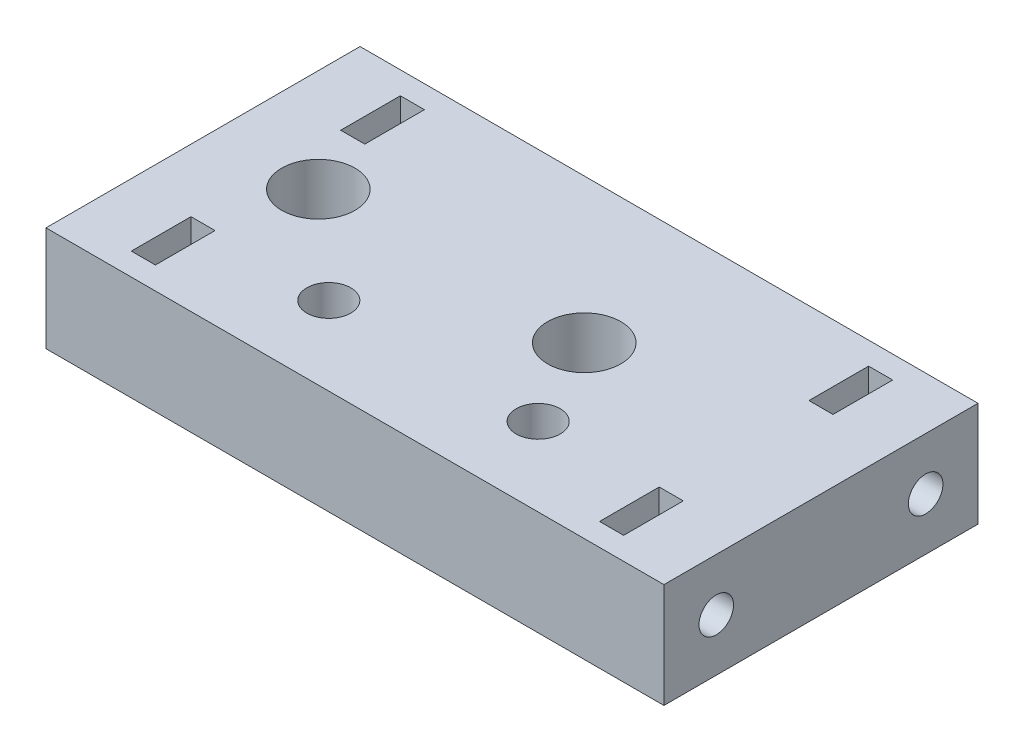
from build123d import *

# Parameters (mm, degrees)
SKETCH1_W           = 59.0272
SKETCH1_H           = 30
BOSS_EXTRUDE1_DEPTH = 10
SKETCH2_R           = 2.1
CUT_EXTRUDE1_DEPTH  = 35.58399319
SKETCH3_R           = 1.65
CUT_EXTRUDE2_DEPTH  = 12
CUT_EXTRUDE3_START  = -12
SKETCH4_R           = 1.65
CUT_EXTRUDE3_DEPTH  = 12
CUT_EXTRUDE4_DEPTH  = 2.3
CUT_EXTRUDE5_DEPTH  = 2.3
SKETCH7_R           = 3.5
CUT_EXTRUDE6_DEPTH  = 35.58399319


with BuildPart() as part:
    # Sketch1 → Boss-Extrude1 (new body)
    with BuildSketch(Plane(origin=(0, 0, 0), x_dir=(1, 0, 0), z_dir=(0, 1, 0))):
        Rectangle(SKETCH1_W, SKETCH1_H)
    extrude(amount=BOSS_EXTRUDE1_DEPTH)

    # Sketch2 → Cut-Extrude1 (cut, through all)
    with BuildSketch(Plane(origin=(0, 10, 0), x_dir=(1, 0, 0), z_dir=(0, 1, 0))):
        with Locations((-10, -7.5)):
            Circle(SKETCH2_R)
        with Locations((10, -7.5)):
            Circle(SKETCH2_R)
    extrude(amount=-CUT_EXTRUDE1_DEPTH, mode=Mode.SUBTRACT)

    # Sketch3 → Cut-Extrude2 (cut)
    with BuildSketch(Plane(origin=(29.5136, 0, 0), x_dir=(0, 0, -1), z_dir=(1, 0, 0))):
        with Locations((-10, 5)):
            Circle(SKETCH3_R)
        with Locations((10, 5)):
            Circle(SKETCH3_R)
    extrude(amount=-CUT_EXTRUDE2_DEPTH, mode=Mode.SUBTRACT)

    # Sketch4 → Cut-Extrude3 (cut)
    with BuildSketch(Plane.ZY.offset(29.5136).offset(CUT_EXTRUDE3_START)):
        with Locations((-10, 5)):
            Circle(SKETCH4_R)
        with Locations((10, 5)):
            Circle(SKETCH4_R)
    extrude(amount=CUT_EXTRUDE3_DEPTH, mode=Mode.SUBTRACT)

    # Sketch5 → Cut-Extrude4 (cut)
    with BuildSketch(Plane(origin=(23.5136, 0, 0), x_dir=(0, 0, -1), z_dir=(1, 0, 0))):
        Polygon((-12.85, 6.645448267), (-12.85, 10), (-7.15, 10), (-7.15, 6.645448267), (-7.15, 3.354551733), (-10, 1.709103466), (-12.85, 3.354551733), align=None)
        Polygon((7.15, 6.645448267), (7.15, 3.354551733), (10, 1.709103466), (12.85, 3.354551733), (12.85, 6.645448267), (12.85, 10), (7.15, 10), align=None)
    extrude(amount=-CUT_EXTRUDE4_DEPTH, mode=Mode.SUBTRACT)

    # Sketch6 → Cut-Extrude5 (cut)
    with BuildSketch(Plane.ZY.offset(23.5136)):
        Polygon((-12.85, 6.645448267), (-12.85, 10), (-7.15, 10), (-7.15, 6.645448267), (-7.15, 3.354551733), (-10, 1.709103466), (-12.85, 3.354551733), align=None)
        Polygon((7.15, 6.645448267), (7.15, 3.354551733), (10, 1.709103466), (12.85, 3.354551733), (12.85, 6.645448267), (12.85, 10), (7.15, 10), align=None)
    extrude(amount=-CUT_EXTRUDE5_DEPTH, mode=Mode.SUBTRACT)

    # Sketch7 → Cut-Extrude6 (cut, through all)
    with BuildSketch(Plane(origin=(0, 10, 0), x_dir=(1, 0, 0), z_dir=(0, 1, 0))):
        with Locations((5.7, 1.2)):
            Circle(SKETCH7_R)
        with Locations((-19.7, 1.2)):
            Circle(SKETCH7_R)
    extrude(amount=-CUT_EXTRUDE6_DEPTH, mode=Mode.SUBTRACT)


solid = part.part
